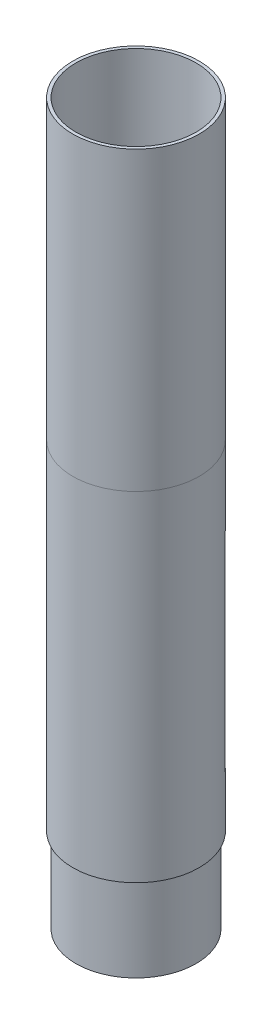
from build123d import *

# Parameters (mm, degrees)
DIAMETERS_IN_R                        = 29.8605
DIAMETERS_IN_R_2                      = 28.374
RECOVERY_BAY_DEPTH                    = 300
WHAT_OUTLINE_R                        = 28.374
WHAT_DEPTH                            = 130
BOSS_EXTRUDE3_START                   = -40
BOSS_EXTRUDE3_OUTLINE_R               = 28.374
BOSS_EXTRUDE3_OUTLINE_R_2             = 26.5
BOSS_EXTRUDE3_DEPTH                   = 40
CUT_EXTRUDE1_DEPTH                    = 10
CUT_EXTRUDE1_DEPTH_BACK               = 40
WIREPASSTHROUGH1_DEPTH                = 176.166489148
WIREPASSTHROUGH1_DEPTH_BACK           = 176.166489148
SKETCH3_R                             = 3.25
WIREPASSTHROUGH2_DEPTH                = 176.166489148
WIREPASSTHROUGH2_DEPTH_BACK           = 176.166489148
SKETCH5_R                             = 1.625
SKETCH9_W                             = 35
SKETCH9_H                             = 60
SKETCH9_W_2                           = 4
SKETCH9_H_2                           = 19.3
BATTERYPOCKET_DEPTH                   = 6
ATMOSPHERIC_SAMPLING_PORT_REACH       = 304.239
SKETCH10_R                            = 1.75
INCOMPREHENSIBLE7_DEPTH               = 20
INCOMPREHENSIBLE7_DEPTH_BACK          = 20
SKETCH11_R                            = 28.774
SKETCH11_R_2                          = 28.374
SKETCH12_R                            = 28.374
SKETCH12_R_2                          = 25.874
CHUTE_COUPLER_DEPTH                   = 19.5
M3_THREADED_INSERT_POCKETS_DEPTH      = 305.106081712
M3_THREADED_INSERT_POCKETS_DEPTH_BACK = 3
SKETCH15_R                            = 1.35


# Read off the part's stored shape, not the designer's step: what, Boss-Extrude3
with BuildPart() as part:
    # diameters-in → recovery-bay (new body)
    with BuildSketch(Plane(origin=(0, 0, 0), x_dir=(1, 0, 0), z_dir=(0, 1, 0))):
        with Locations(Location((0, 0, 0), (0, 0, 270))):
            Circle(DIAMETERS_IN_R)
        with Locations(Location((0, 0, 0), (0, 0, 270))):
            Circle(DIAMETERS_IN_R_2, mode=Mode.SUBTRACT)
    extrude(amount=RECOVERY_BAY_DEPTH)

    # what outline → what (add)
    with BuildSketch(Plane(origin=(0, 0, 0), x_dir=(1, 0, 0), z_dir=(0, 1, 0))):
        Circle(WHAT_OUTLINE_R)
    extrude(amount=WHAT_DEPTH)

    # Boss-Extrude3 outline → Boss-Extrude3 (add)
    with BuildSketch(Plane(origin=(0, 0, 0), x_dir=(1, 0, 0), z_dir=(0, 1, 0)).offset(BOSS_EXTRUDE3_START)):
        Circle(BOSS_EXTRUDE3_OUTLINE_R)
        Circle(BOSS_EXTRUDE3_OUTLINE_R_2, mode=Mode.SUBTRACT)
    extrude(amount=BOSS_EXTRUDE3_DEPTH)

    # Sketch2 → Cut-Extrude1 (cut, two sides: drawn at the far end of the back side and taken through both)
    with BuildSketch(Plane.XY.offset(-CUT_EXTRUDE1_DEPTH_BACK)):
        Polygon((23.385, 109.475), (23.385, 106.975), (23.385, 41.625), (23.385, 39.125), (23.385, 25), (-23.385, 25), (-23.385, 39.125), (-23.385, 41.625), (-23.385, 106.975), (-23.385, 109.475), (-23.385, 123.6), (23.385, 123.6), align=None)
    extrude(amount=CUT_EXTRUDE1_DEPTH + CUT_EXTRUDE1_DEPTH_BACK, mode=Mode.SUBTRACT)

    # Sketch3 → wirepassthrough1 (cut, two sides: drawn at the far end of the back side and taken through both)
    with BuildSketch(Plane(origin=(0, 130, 0), x_dir=(1, 0, 0), z_dir=(0, 1, 0)).offset(-WIREPASSTHROUGH1_DEPTH_BACK)):
        with Locations(Location((0, -22.5, 0), (0, 0, 270))):
            Circle(SKETCH3_R)
    extrude(amount=WIREPASSTHROUGH1_DEPTH + WIREPASSTHROUGH1_DEPTH_BACK, mode=Mode.SUBTRACT)

    # Sketch5 → wirepassthrough2 (cut, two sides: drawn at the far end of the back side and taken through both)
    with BuildSketch(Plane(origin=(0, 130, 0), x_dir=(1, 0, 0), z_dir=(0, 1, 0)).offset(-WIREPASSTHROUGH2_DEPTH_BACK)):
        with Locations(Location((0, 18, 0), (0, 0, 270))):
            Circle(SKETCH5_R)
        with Locations(Location((0, 0, 0), (0, 0, 270))):
            Circle(SKETCH5_R)
    extrude(amount=WIREPASSTHROUGH2_DEPTH + WIREPASSTHROUGH2_DEPTH_BACK, mode=Mode.SUBTRACT)

    # Sketch9 → batterypocket (cut)
    with BuildSketch(Plane(origin=(0, 0, 10), x_dir=(-1, 0, 0), z_dir=(0, 0, -1))):
        with Locations((0, 74.3)):
            Rectangle(SKETCH9_W, SKETCH9_H)
        with Locations((0, 34.65)):
            Rectangle(SKETCH9_W_2, SKETCH9_H_2)
    extrude(amount=-BATTERYPOCKET_DEPTH, mode=Mode.SUBTRACT)

    # atmospheric-sampling-port: up to this plane
    atmospheric_sampling_port_end = Plane(origin=(-23.385, 0, 10), z_dir=(1, 0, 0))
    # Sketch10 → atmospheric-sampling-port (cut, up to the surface)
    with BuildSketch(Plane(origin=(0.8075, 0.8075, 0), x_dir=(0, 0, -1), z_dir=(0.7071067811865488, 0.7071067811865464, 0)), mode=Mode.PRIVATE) as atmospheric_sampling_port_sk1:
        with Locations(Location((0, 45.449199077, 0), (0, 0, 270))):
            Circle(SKETCH10_R)
    atmospheric_sampling_port_tool1 = split(extrude(atmospheric_sampling_port_sk1.sketch, amount=ATMOSPHERIC_SAMPLING_PORT_REACH, mode=Mode.PRIVATE), bisect_by=atmospheric_sampling_port_end, keep=Keep.BOTH, mode=Mode.PRIVATE)
    add(atmospheric_sampling_port_tool1.solids().sort_by_distance((-31.329937, 32.944937, 0))[0], mode=Mode.SUBTRACT)


with BuildPart() as body_2:
    # Split1: the piece on the far side of the plane
    add(part.part)
    split(bisect_by=Plane(origin=(0, 160, 0), x_dir=(0, 0, -1), z_dir=(0, -1, 0)), keep=Keep.BOTTOM)


with BuildPart() as part_1:
    add(part.part)

    # Split1
    split(bisect_by=Plane(origin=(0, 160, 0), x_dir=(0, 0, -1), z_dir=(0, -1, 0)), keep=Keep.TOP)


with BuildPart() as incomprehensible7_tool:
    # Sketch11 → incomprehensible7 (new, two sides: drawn at the far end of the back side and taken through both)
    with BuildSketch(Plane(origin=(0, 160, 0), x_dir=(-1, 0, 0), z_dir=(0, -1, 0)).offset(-INCOMPREHENSIBLE7_DEPTH_BACK)):
        with Locations(Location((0, 0, 0), (0, 0, 90))):
            Circle(SKETCH11_R)
        with Locations(Location((0, 0, 0), (0, 0, 90))):
            Circle(SKETCH11_R_2, mode=Mode.SUBTRACT)
    extrude(amount=INCOMPREHENSIBLE7_DEPTH + INCOMPREHENSIBLE7_DEPTH_BACK)


with BuildPart() as part_2:
    add(part_1.part)

    # incomprehensible7: cut by incomprehensible7_tool
    add(incomprehensible7_tool.part, mode=Mode.SUBTRACT)

    # Sketch15 → m3-threaded-insert-pockets (cut, two sides: drawn at the far end of the back side and taken through both)
    with BuildSketch(Plane(origin=(0, 0, 10), x_dir=(-1, 0, 0), z_dir=(0, 0, -1)).offset(-M3_THREADED_INSERT_POCKETS_DEPTH_BACK)):
        with Locations(Location((-12.7, 112.4, 0), (0, 0, 180))):
            Circle(SKETCH15_R)
        with Locations(Location((12.7, 112.4, 0), (0, 0, 180))):
            Circle(SKETCH15_R)
        with Locations(Location((-12.7, 36.2, 0), (0, 0, 180))):
            Circle(SKETCH15_R)
        with Locations(Location((12.7, 36.2, 0), (0, 0, 180))):
            Circle(SKETCH15_R)
    extrude(amount=M3_THREADED_INSERT_POCKETS_DEPTH + M3_THREADED_INSERT_POCKETS_DEPTH_BACK, mode=Mode.SUBTRACT)


with BuildPart() as body_2_1:
    add(body_2.part)

    # incomprehensible7: cut by incomprehensible7_tool
    add(incomprehensible7_tool.part, mode=Mode.SUBTRACT)


with BuildPart() as body_3:
    # Sketch12 → chute-coupler (new, symmetric)
    with BuildSketch(Plane(origin=(0, 160, 0), x_dir=(-1, 0, 0), z_dir=(0, -1, 0))):
        with Locations(Location((0, 0, 0), (0, 0, 90))):
            Circle(SKETCH12_R)
        with Locations(Location((0, 0, 0), (0, 0, 90))):
            Circle(SKETCH12_R_2, mode=Mode.SUBTRACT)
    extrude(amount=CHUTE_COUPLER_DEPTH, both=True)


solid = Compound([part_2.part, body_2_1.part, body_3.part])
